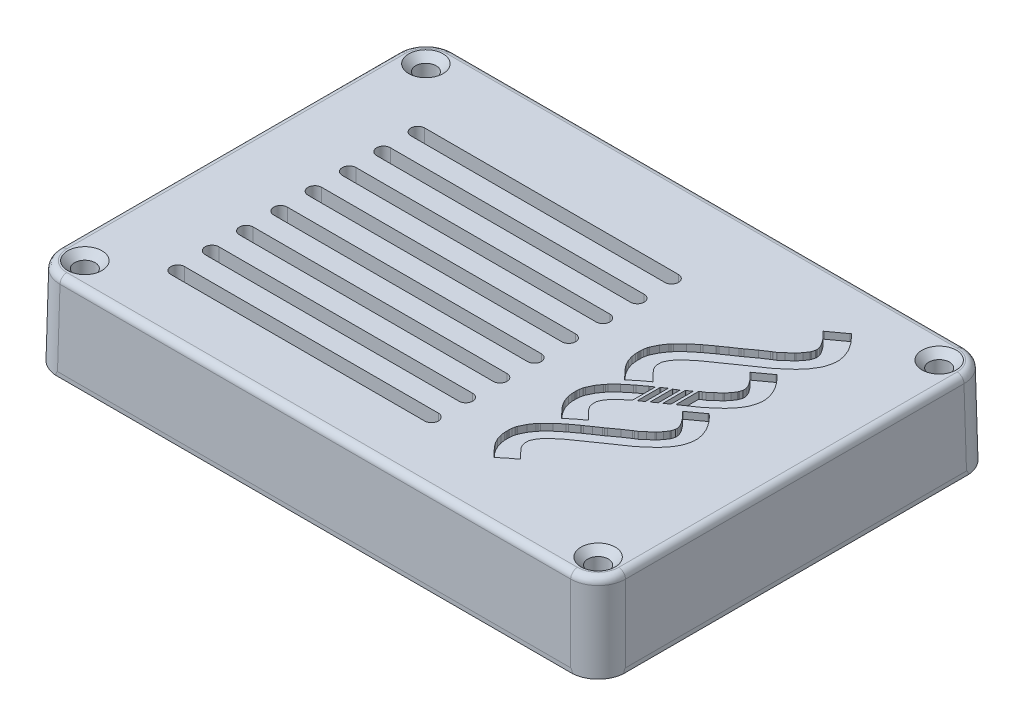
from build123d import *
from OCP.BRepFilletAPI import BRepFilletAPI_MakeChamfer

# Parameters (mm, degrees)
SKETCH1_W               = 82.8
SKETCH1_H               = 57.7
BOSS_EXTRUDE1_DEPTH     = 12.6
CHAMFER1_SIZE           = 12
CHAMFER1_SIZE2          = 0.2
FILLET1_R               = 4
SKETCH2_R               = 1.5
CUT_EXTRUDE1_DEPTH      = 12.6
FILLET2_R               = 1
CHAMFER2_SIZE           = 1
CUT_EXTRUDE2_DEPTH      = 10.4
CUT_EXTRUDE_THIN1_DEPTH = 1
CUT_EXTRUDE3_DEPTH      = 10.4
CUT_EXTRUDE5_DEPTH      = 1


with BuildPart() as part:
    # Sketch1 → Boss-Extrude1 (new body)
    with BuildSketch(Plane(origin=(0, 0, 0), x_dir=(1, 0, 0), z_dir=(0, 1, 0))):
        with Locations((-67.329666271, 2.285365627)):
            Rectangle(SKETCH1_W, SKETCH1_H)
    extrude(amount=BOSS_EXTRUDE1_DEPTH)

    # Chamfer1: one chamfer whose edges measure the first distance from different faces: ONE call of the kernel's chamfer builder (chamfer() names one face for all edges)
    chamfer1_edges_1 = [part.edges().sort_by_distance(p)[0] for p in [
        (-108.729666271, 12.6, -2.285365627),
    ]]
    chamfer1_side_1 = [part.faces().sort_by_distance(p)[0] for p in [
        (-108.729666271, 6.3, -2.285365627),
    ]]
    chamfer1_edges_2 = [part.edges().sort_by_distance(p)[0] for p in [
        (-67.329666271, 12.6, 26.564634373),
    ]]
    chamfer1_side_2 = [part.faces().sort_by_distance(p)[0] for p in [
        (-67.329666271, 6.3, 26.564634373),
    ]]
    chamfer1_edges_3 = [part.edges().sort_by_distance(p)[0] for p in [
        (-25.929666271, 12.6, -2.285365627),
    ]]
    chamfer1_side_3 = [part.faces().sort_by_distance(p)[0] for p in [
        (-25.929666271, 6.3, -2.285365627),
    ]]
    chamfer1_edges_4 = [part.edges().sort_by_distance(p)[0] for p in [
        (-67.329666271, 12.6, -31.135365627),
    ]]
    chamfer1_side_4 = [part.faces().sort_by_distance(p)[0] for p in [
        (-67.329666271, 6.3, -31.135365627),
    ]]
    chamfer1 = BRepFilletAPI_MakeChamfer(part.part.solid().wrapped)
    for e in chamfer1_edges_1:
        chamfer1.Add(CHAMFER1_SIZE, CHAMFER1_SIZE2, e.wrapped, chamfer1_side_1[0].wrapped)  # the first distance lies on this face
    for e in chamfer1_edges_2:
        chamfer1.Add(CHAMFER1_SIZE, CHAMFER1_SIZE2, e.wrapped, chamfer1_side_2[0].wrapped)  # the first distance lies on this face
    for e in chamfer1_edges_3:
        chamfer1.Add(CHAMFER1_SIZE, CHAMFER1_SIZE2, e.wrapped, chamfer1_side_3[0].wrapped)  # the first distance lies on this face
    for e in chamfer1_edges_4:
        chamfer1.Add(CHAMFER1_SIZE, CHAMFER1_SIZE2, e.wrapped, chamfer1_side_4[0].wrapped)  # the first distance lies on this face
    add(Compound.cast(chamfer1.Shape()), mode=Mode.REPLACE)

    # Fillet1
    # the kernel refuses this fillet: 4 mm, written as the material it takes off along each edge
    with BuildSketch(Plane(origin=(-108.896240397, -9.394447529, -31.301939752), x_dir=(0.9998611785930702, -0.016659725275086107, -0.0002776620879181018), z_dir=(0.016662038965156993, 0.9997223379094053, 0.016662038965156698)), Plane(origin=(-108.896240397, -9.394447529, 26.731208499), x_dir=(-0.0002776620879180821, -0.016659725275085812, -0.9998611785930703), z_dir=(0.016662038965156993, 0.9997223379094053, -0.016662038965156698))) as fillet1_piece_1:
        with BuildLine():
            CenterArc((FILLET1_R * 0.999722337909, -FILLET1_R), FILLET1_R, 90, 89.984088925)
            Line((-FILLET1_R * 0.000277623531772, -FILLET1_R * 0.999722299361), (0, 0))
            Line((0, 0), (FILLET1_R * 0.999722337909, 0))
        make_face()
    extrude(amount=31.997779629, mode=Mode.SUBTRACT)
    with BuildSketch(Plane(origin=(-25.763092146, -9.394447529, -31.301939752), x_dir=(-0.9998611785930702, -0.016659725275085812, -0.0002776620879180895), z_dir=(-0.016662038965156698, 0.9997223379094053, 0.016662038965156698)), Plane(origin=(-25.763092146, -9.394447529, 26.731208499), x_dir=(0.0002776620879180895, -0.016659725275085812, -0.9998611785930703), z_dir=(-0.016662038965156698, 0.9997223379094053, -0.016662038965156698))) as fillet1_piece_2:
        with BuildLine():
            CenterArc((FILLET1_R * 0.999722337909, FILLET1_R), FILLET1_R, 180.015911075, 89.984088925)
            Line((-FILLET1_R * 0.000277623531773, FILLET1_R * 0.999722299361), (0, 0))
            Line((0, 0), (FILLET1_R * 0.999722337909, 0))
        make_face()
    extrude(amount=31.997779629, mode=Mode.SUBTRACT)

    # Sketch2 → Cut-Extrude1 (cut)
    with BuildSketch(Plane.XZ):
        with Locations(Location((-104.739110754, 22.574078856, 0), (0, 0, 270))):
            Circle(SKETCH2_R)
        with Locations(Location((-29.920221788, 22.574078856, 0), (0, 0, 270))):
            Circle(SKETCH2_R)
        with Locations(Location((-104.739110754, -27.14481011, 0), (0, 0, 270))):
            Circle(SKETCH2_R)
        with Locations(Location((-29.920221788, -27.14481011, 0), (0, 0, 270))):
            Circle(SKETCH2_R)
    extrude(amount=-CUT_EXTRUDE1_DEPTH, mode=Mode.SUBTRACT)

    # Fillet2
    fillet2_edges = [part.edges().sort_by_distance(p)[0] for p in [
        (-67.329666271, 12.6, -30.935365627),
        (-67.329666271, 12.6, 26.364634373),
        (-26.129666271, 12.6, -2.285365627),
        (-108.529666271, 12.6, -2.285365627),
        (-107.358323444, 12.6, 25.193291546),
        (-27.301009098, 12.6, 25.193291546),
        (-27.301009098, 12.6, -29.7640228),
        (-107.358323444, 12.6, -29.7640228),
    ]]
    fillet(fillet2_edges, radius=FILLET2_R)

    # Chamfer2
    chamfer2_edges = [part.edges().sort_by_distance(p)[0] for p in [
        (-104.739110754, 12.6, 24.074078856),
        (-29.920221788, 12.6, 24.074078856),
        (-104.739110754, 12.6, -25.64481011),
        (-29.920221788, 12.6, -25.64481011),
    ]]
    chamfer(chamfer2_edges, length=CHAMFER2_SIZE)

    # Sketch3 → Cut-Extrude2 (cut)
    with BuildSketch(Plane.XZ):
        with BuildLine():
            Line((-99.765131832, 22.064634373), (-34.89420071, 22.064634373))
            ThreePointArc((-34.89420071, 22.064634373), (-33.455755694, 19.03854495), (-30.429666271, 17.600099934))
            Line((-30.429666271, 17.600099934), (-30.429666271, -22.170831188))
            ThreePointArc((-30.429666271, -22.170831188), (-33.455755694, -23.609276204), (-34.89420071, -26.635365627))
            Line((-34.89420071, -26.635365627), (-99.765131832, -26.635365627))
            ThreePointArc((-99.765131832, -26.635365627), (-101.203576848, -23.609276204), (-104.229666271, -22.170831188))
            Line((-104.229666271, -22.170831188), (-104.229666271, 17.600099934))
            ThreePointArc((-104.229666271, 17.600099934), (-101.203576848, 19.03854495), (-99.765131832, 22.064634373))
        make_face()
    extrude(amount=-CUT_EXTRUDE2_DEPTH, mode=Mode.SUBTRACT)

    # Sketch3<4> → Cut-Extrude-Thin1 (cut)
    with BuildSketch(Plane.XZ):
        with BuildLine():
            Line((-102.135604608, 24.064634373), (-32.523727934, 24.064634373))
            ThreePointArc((-32.523727934, 24.064634373), (-32.041542132, 20.452758513), (-28.429666271, 19.97057271))
            Line((-28.429666271, 19.97057271), (-28.429666271, -24.541303964))
            ThreePointArc((-28.429666271, -24.541303964), (-32.041542132, -25.023489766), (-32.523727934, -28.635365627))
            Line((-32.523727934, -28.635365627), (-102.135604608, -28.635365627))
            ThreePointArc((-102.135604608, -28.635365627), (-102.617790411, -25.023489766), (-106.229666271, -24.541303964))
            Line((-106.229666271, -24.541303964), (-106.229666271, 19.97057271))
            ThreePointArc((-106.229666271, 19.97057271), (-102.617790411, 20.452758513), (-102.135604608, 24.064634373))
        make_face()
        with BuildLine():
            Line((-100.769305307, 23.064634373), (-33.890027235, 23.064634373))
            ThreePointArc((-33.890027235, 23.064634373), (-32.748648913, 19.745651731), (-29.429666271, 18.604273409))
            Line((-29.429666271, 18.604273409), (-29.429666271, -23.175004663))
            ThreePointArc((-29.429666271, -23.175004663), (-32.748648913, -24.316382985), (-33.890027235, -27.635365627))
            Line((-33.890027235, -27.635365627), (-100.769305307, -27.635365627))
            ThreePointArc((-100.769305307, -27.635365627), (-101.910683629, -24.316382985), (-105.229666271, -23.175004663))
            Line((-105.229666271, -23.175004663), (-105.229666271, 18.604273409))
            ThreePointArc((-105.229666271, 18.604273409), (-101.910683629, 19.745651731), (-100.769305307, 23.064634373))
        make_face(mode=Mode.SUBTRACT)
    extrude(amount=-CUT_EXTRUDE_THIN1_DEPTH, mode=Mode.SUBTRACT)

    # Sketch4 → Cut-Extrude3 (cut)
    with BuildSketch(Plane(origin=(0, 12.6, 0), x_dir=(1, 0, 0), z_dir=(0, 1, 0))):
        with BuildLine():
            Line((-96.729666271, 18.951893414), (-59.729666271, 18.951893414))
            ThreePointArc((-59.729666271, 18.951893414), (-58.729666271, 17.951893414), (-59.729666271, 16.951893414))
            Line((-59.729666271, 16.951893414), (-96.729666271, 16.951893414))
            ThreePointArc((-96.729666271, 16.951893414), (-97.729666271, 17.951893414), (-96.729666271, 18.951893414))
        make_face()
        with BuildLine():
            Line((-96.729666271, 13.951893414), (-59.729666271, 13.951893414))
            ThreePointArc((-59.729666271, 13.951893414), (-58.729666271, 12.951893414), (-59.729666271, 11.951893414))
            Line((-59.729666271, 11.951893414), (-96.729666271, 11.951893414))
            ThreePointArc((-96.729666271, 11.951893414), (-97.729666271, 12.951893414), (-96.729666271, 13.951893414))
        make_face()
        with BuildLine():
            Line((-96.729666271, 8.951893414), (-59.729666271, 8.951893414))
            ThreePointArc((-59.729666271, 8.951893414), (-58.729666271, 7.951893414), (-59.729666271, 6.951893414))
            Line((-59.729666271, 6.951893414), (-96.729666271, 6.951893414))
            ThreePointArc((-96.729666271, 6.951893414), (-97.729666271, 7.951893414), (-96.729666271, 8.951893414))
        make_face()
        with BuildLine():
            Line((-96.729666271, 3.951893414), (-59.729666271, 3.951893414))
            ThreePointArc((-59.729666271, 3.951893414), (-58.729666271, 2.951893414), (-59.729666271, 1.951893414))
            Line((-59.729666271, 1.951893414), (-96.729666271, 1.951893414))
            ThreePointArc((-96.729666271, 1.951893414), (-97.729666271, 2.951893414), (-96.729666271, 3.951893414))
        make_face()
        with BuildLine():
            Line((-96.729666271, -1.048106586), (-59.729666271, -1.048106586))
            ThreePointArc((-59.729666271, -1.048106586), (-58.729666271, -2.048106586), (-59.729666271, -3.048106586))
            Line((-59.729666271, -3.048106586), (-96.729666271, -3.048106586))
            ThreePointArc((-96.729666271, -3.048106586), (-97.729666271, -2.048106586), (-96.729666271, -1.048106586))
        make_face()
        with BuildLine():
            Line((-96.729666271, -6.048106586), (-59.729666271, -6.048106586))
            ThreePointArc((-59.729666271, -6.048106586), (-58.729666271, -7.048106586), (-59.729666271, -8.048106586))
            Line((-59.729666271, -8.048106586), (-96.729666271, -8.048106586))
            ThreePointArc((-96.729666271, -8.048106586), (-97.729666271, -7.048106586), (-96.729666271, -6.048106586))
        make_face()
        with BuildLine():
            Line((-96.729666271, -11.048106586), (-59.729666271, -11.048106586))
            ThreePointArc((-59.729666271, -11.048106586), (-58.729666271, -12.048106586), (-59.729666271, -13.048106586))
            Line((-59.729666271, -13.048106586), (-96.729666271, -13.048106586))
            ThreePointArc((-96.729666271, -13.048106586), (-97.729666271, -12.048106586), (-96.729666271, -11.048106586))
        make_face()
        with BuildLine():
            Line((-96.729666271, -16.048106586), (-59.729666271, -16.048106586))
            ThreePointArc((-59.729666271, -16.048106586), (-58.729666271, -17.048106586), (-59.729666271, -18.048106586))
            Line((-59.729666271, -18.048106586), (-96.729666271, -18.048106586))
            ThreePointArc((-96.729666271, -18.048106586), (-97.729666271, -17.048106586), (-96.729666271, -16.048106586))
        make_face()
    extrude(amount=-CUT_EXTRUDE3_DEPTH, mode=Mode.SUBTRACT)

    # Sketch5 → Cut-Extrude5 (cut)
    with BuildSketch(Plane(origin=(0, 12.6, -12.6), x_dir=(1, 0, 0), z_dir=(0, -1, 0))):
        Polygon((-52.474635672, 25.551335505), (-52.474635672, 25.659671505), (-52.474635672, 25.706020305), (-52.473099672, 25.828938705), (-52.472523672, 25.843530705), (-52.472043672, 25.862788305), (-52.472043672, 25.872685905), (-52.470891672, 25.952903505), (-52.470891672, 25.979457105), (-52.470891672, 26.013316305), (-52.471467672, 26.018529105), (-52.471467672, 26.062276305), (-52.471467672, 26.076340305), (-52.471467672, 26.279457105), (-52.382955672, 26.887789905), (-52.154763672, 27.595089105), (-51.844395672, 28.189348305), (-51.599019672, 28.550298705), (-51.508491672, 28.662791505), (-51.454251672, 28.731018705), (-51.282891672, 28.929460305), (-50.980971672, 29.261231505), (-50.603307672, 29.658107025), (-50.265291672, 30.003419025), (-50.151723672, 30.117481809), (-50.075211672, 30.195085905), (-49.994379672, 30.121648401), (-49.899051672, 30.035190225), (-48.868971672, 29.194564305), (-48.755883672, 29.111226705), (-48.012651672, 28.562788305), (-47.906379672, 28.484673105), (-47.999595672, 28.390909905), (-48.109035672, 28.281537105), (-48.435051672, 27.950817105), (-48.793323672, 27.577377105), (-49.072011672, 27.275303505), (-49.218891672, 27.107063505), (-49.265355672, 27.049242705), (-49.309995672, 26.994561105), (-49.526283672, 26.627380305), (-49.653867672, 26.196129105), (-49.653867672, 26.052378705), (-49.653867672, 26.037796305), (-49.653867672, 26.033629905), (-49.653291672, 25.993002705), (-49.653291672, 25.978938705), (-49.653291672, 25.939348305), (-49.654827672, 25.833633105), (-49.654827672, 25.820087505), (-49.655307672, 25.803421905), (-49.655307672, 25.791969105), (-49.655883672, 25.782061905), (-49.656939672, 25.690391505), (-49.656939672, 25.659671505), (-49.656939672, 25.627377105), (-49.653291672, 25.533633105), (-49.652811672, 25.528938705), (-49.614795672, 25.419047505), (-49.375179672, 24.911236305), (-49.073067672, 24.465393105), (-49.003371672, 24.385713105), (-48.871467672, 24.234676305), (-48.139755672, 23.508628305), (-47.300139672, 22.809671505), (-47.113707672, 22.672161105), (-44.094891672, 20.554957905), (-42.072075672, 19.160173905), (-41.981451672, 19.097197905), (-41.147595672, 18.522733905), (-41.142315672, 18.518509905), (-41.137707672, 18.514381905), (-39.982453272, 17.506573905), (-39.560571672, 17.133613905), (-39.556414872, 17.129485905), (-39.457976472, 17.032621905), (-39.453291672, 17.027917905), (-39.352242072, 16.918477905), (-39.051205272, 16.585741905), (-38.648600472, 16.098157905), (-38.271522072, 15.547789905), (-38.014750872, 15.079501905), (-37.943912472, 14.916973905), (-37.883490072, 14.777389905), (-37.671003672, 14.076301905), (-37.579333272, 13.447789905), (-37.579333272, 13.237741905), (-37.579333272, 12.977869905), (-37.723083672, 12.198157905), (-38.055896472, 11.343469905), (-38.150677272, 11.175373905), (-38.227774872, 11.038861905), (-38.474120472, 10.636717905), (-38.836626072, 10.125709905), (-39.280894872, 9.609613905), (-39.702776472, 9.187789905), (-39.849637272, 9.053869905), (-39.918910872, 8.991469905), (-39.993906072, 9.046189905), (-42.060555672, 10.553389905), (-42.175179672, 10.636717905), (-42.068907672, 10.731085905), (-41.905419672, 10.875757905), (-41.233995672, 11.574253905), (-40.720971672, 12.281101905), (-40.636587672, 12.429997905), (-40.595979672, 12.502957905), (-40.456395672, 12.845581905), (-40.397547672, 13.140973905), (-40.397547672, 13.239373905), (-40.397547672, 13.406029905), (-40.525707672, 13.846189905), (-40.551243672, 13.905517905), (-40.604331672, 14.027917905), (-40.974123672, 14.590957905), (-41.436651672, 15.123757905), (-41.536107672, 15.231085905), (-42.220491672, 15.836269905), (-42.836139672, 16.380589905), (-42.865803672, 16.397773905), (-43.171563672, 16.581517905), (-43.202763672, 16.600813905), (-43.377771672, 16.709581905), (-44.372523672, 17.381005905), (-45.518379672, 18.218029905), (-45.768939672, 18.409165905), (-45.942411672, 18.519085905), (-46.785579672, 19.089325905), (-47.578251672, 19.655533905), (-47.726283672, 19.762765905), (-47.736171672, 19.750861905), (-47.822571672, 19.814317905), (-48.841899672, 20.566477905), (-49.069419672, 20.734151505), (-50.101707672, 21.594570705), (-51.009963672, 22.498209105), (-51.175179672, 22.687271505), (-51.303339672, 22.833633105), (-51.852267672, 23.640916305), (-52.277163672, 24.543009105), (-52.342923672, 24.736228305), (-52.372011672, 24.821649105), (-52.452843672, 25.226337105), align=None)
        Polygon((-39.918910872, -0.871570095), (-39.993906072, -0.816946095), (-42.060555672, 0.690445905), (-42.175179672, 0.773773905), (-42.068907672, 0.868045905), (-41.905419672, 1.012813905), (-41.233995672, 1.711213905), (-40.720971672, 2.418061905), (-40.636587672, 2.566957905), (-40.595979672, 2.639917905), (-40.455915672, 2.982541905), (-40.397547672, 3.277933905), (-40.397547672, 3.376237905), (-40.397547672, 3.542989905), (-40.525131672, 3.983053905), (-40.550667672, 4.042381905), (-40.603851672, 4.164781905), (-40.974123672, 4.727917905), (-41.436651672, 5.261197905), (-41.536107672, 5.368525905), (-42.220491672, 5.973229905), (-42.836139672, 6.517453905), (-42.865227672, 6.534637905), (-43.170987672, 6.718573905), (-43.202763672, 6.737773905), (-43.226763672, 6.752461905), (-43.469931672, 6.907597905), (-43.494987672, 6.923725905), (-43.494987672, 10.277869905), (-42.072075672, 9.297229905), (-41.981451672, 9.234637905), (-41.147595672, 8.659597905), (-41.142315672, 8.656045905), (-41.137707672, 8.651341905), (-39.982453272, 7.643533905), (-39.560571672, 7.270573905), (-39.558498072, 7.268557905), (-39.555896472, 7.266445905), (-39.457976472, 7.169581905), (-39.455893272, 7.167469905), (-39.452773272, 7.164781905), (-39.351723672, 7.055533905), (-39.051205272, 6.722701905), (-38.648600472, 6.235213905), (-38.271522072, 5.684653905), (-38.014750872, 5.216461905), (-37.943912472, 5.053837905), (-37.883490072, 4.914445905), (-37.671003672, 4.213357905), (-37.579333272, 3.585229905), (-37.579333272, 3.375373905), (-37.579333272, 3.115309905), (-37.723083672, 2.335213905), (-38.055896472, 1.480525905), (-38.150677272, 1.312237905), (-38.227774872, 1.175725905), (-38.474120472, 0.773773905), (-38.836626072, 0.262861905), (-39.280894872, -0.253330095), (-39.703294872, -0.675154095), (-39.850165272, -0.809074095), align=None)
        Polygon((-47.386635672, 13.014829905), (-47.211627672, 12.883597905), (-47.211627672, 9.528973905), (-47.255883672, 9.560653905), (-47.685099672, 9.870061905), (-47.726283672, 9.899725905), (-47.736171672, 9.887725905), (-47.822571672, 9.951853905), (-48.841899672, 10.703341905), (-49.069419672, 10.871053905), (-50.101707672, 11.731981905), (-51.009579672, 12.635245905), (-51.174699672, 12.824269905), (-51.302763672, 12.970573905), (-51.852267672, 13.777933905), (-52.277739672, 14.680045905), (-52.343307672, 14.873197905), (-52.372491672, 14.958637905), (-52.452843672, 15.363373905), (-52.474635672, 15.688237905), (-52.474635672, 15.796717905), (-52.474635672, 15.842989905), (-52.473099672, 15.965869905), (-52.472523672, 15.980557905), (-52.472043672, 15.999757905), (-52.472043672, 16.009645905), (-52.470891672, 16.090381905), (-52.470891672, 16.116973905), (-52.470891672, 16.150861905), (-52.471467672, 16.156045905), (-52.471467672, 16.199245905), (-52.471467672, 16.213357905), (-52.471467672, 16.416397905), (-52.382955672, 17.024749905), (-52.154763672, 17.732077905), (-51.844395672, 18.326317905), (-51.599019672, 18.687277905), (-51.508491672, 18.799789905), (-51.454251672, 18.868045905), (-51.282891672, 19.066477905), (-50.980971672, 19.398157905), (-50.603307672, 19.795117905), (-50.265291672, 20.140429905), (-50.151723672, 20.254477905), (-50.074635672, 20.332045905), (-49.994379672, 20.258605905), (-49.899051672, 20.172205905), (-48.868971672, 19.331533905), (-48.755883672, 19.248205905), (-48.012651672, 18.700333905), (-47.906379672, 18.621613905), (-47.999595672, 18.527917905), (-48.109035672, 18.418477905), (-48.435051672, 18.087757905), (-48.793899672, 17.714317905), (-49.072011672, 17.412301905), (-49.219467672, 17.244589905), (-49.265739672, 17.186221905), (-49.309995672, 17.131501905), (-49.526283672, 16.764397905), (-49.653867672, 16.333069905), (-49.653867672, 16.189357905), (-49.653867672, 16.174861905), (-49.653867672, 16.170541905), (-49.653291672, 16.130029905), (-49.653291672, 16.115917905), (-49.653291672, 16.076269905), (-49.655307672, 15.971053905), (-49.655307672, 15.957613905), (-49.655307672, 15.928909905), (-49.655883672, 15.919117905), (-49.656939672, 15.827341905), (-49.656939672, 15.796717905), (-49.656939672, 15.764461905), (-49.653291672, 15.670573905), (-49.652811672, 15.665869905), (-49.614795672, 15.556045905), (-49.375179672, 15.048109905), (-49.073067672, 14.602381905), (-49.003371672, 14.522701905), (-48.877707672, 14.378989905), (-48.181515672, 13.684141905), align=None)
        Polygon((-44.537643672, 7.746157905), (-44.598123672, 7.788301905), (-44.598123672, 7.924813905), (-44.598123672, 11.044525905), (-44.094891672, 10.703341905), (-43.902795672, 10.574797905), (-43.902795672, 7.319053905), (-43.957995672, 7.355533905), align=None)
        Polygon((-46.804299672, 12.592045905), (-46.108491672, 12.104461905), (-46.108491672, 8.767981905), (-46.167915672, 8.807053905), (-46.748139672, 9.200269905), (-46.804299672, 9.239917905), align=None)
        Polygon((-45.637611672, 8.520013905), (-45.701163672, 8.563885905), (-45.701163672, 11.818573905), (-45.005835672, 11.330509905), (-45.005835672, 8.116909905), (-45.069483672, 8.158189905), (-45.352779672, 8.336269905), align=None)
        Polygon((-52.875243672, 5.974285905), (-52.875243672, 6.088813905), (-52.875243672, 6.137773905), (-52.874091672, 6.268525905), (-52.873611672, 6.283597905), (-52.873035672, 6.302989905), (-52.873035672, 6.313357905), (-52.871499672, 6.397741905), (-52.871499672, 6.425389905), (-52.871499672, 6.460717905), (-52.871979672, 6.466381905), (-52.871979672, 6.512269905), (-52.871979672, 6.527341905), (-52.871979672, 6.741517905), (-52.778763672, 7.383661905), (-52.538091672, 8.130061905), (-52.210539672, 8.757613905), (-51.951723672, 9.137773905), (-51.855915672, 9.256525905), (-51.798699672, 9.328429905), (-51.618411672, 9.536653905), (-51.300651672, 9.886669905), (-50.903307672, 10.304461905), (-50.547627672, 10.668013905), (-50.427723672, 10.788301905), (-50.338155672, 10.878445905), (-50.243883672, 10.792909905), (-50.143371672, 10.701901905), (-49.060491672, 9.818029905), (-48.941835672, 9.730573905), (-48.160011672, 9.153901905), (-48.035595672, 9.062317905), (-48.144939672, 8.952973905), (-48.260043672, 8.837773905), (-48.602283672, 8.489869905), (-48.979851672, 8.097229905), (-49.272555672, 7.779469905), (-49.427211672, 7.602925905), (-49.475691672, 7.542061905), (-49.513707672, 7.495117905), (-49.617291672, 7.345069905), (-49.748139672, 7.101901905), (-49.843851672, 6.819085905), (-49.880907672, 6.581485905), (-49.880907672, 6.501901905), (-49.880907672, 6.486637905), (-49.880907672, 6.471661905), (-49.880427672, 6.436717905), (-49.880427672, 6.424813905), (-49.880427672, 6.383053905), (-49.882443672, 6.271117905), (-49.882443672, 6.257101905), (-49.882923672, 6.239917905), (-49.882923672, 6.227917905), (-49.883499672, 6.217453905), (-49.884555672, 6.121069905), (-49.884555672, 6.088813905), (-49.884555672, 6.055501905), (-49.880907672, 5.959117905), (-49.880427672, 5.954413905), (-49.840299672, 5.839309905), (-49.589163672, 5.307661905), (-49.273035672, 4.840909905), (-49.200171672, 4.757581905), (-49.061643672, 4.599181905), (-48.292971672, 3.835789905), (-47.409963672, 3.100813905), (-47.214315672, 2.956525905), (-44.039211672, 0.729517905), (-41.911083672, -0.737746095), (-41.815275672, -0.803890095), (-40.938219672, -1.408498095), (-40.931979672, -1.412818095), (-40.926219672, -1.418002095), (-39.711109272, -2.478898095), (-39.267349272, -2.870482095), (-39.262146072, -2.875762095), (-39.158494872, -2.977810095), (-39.153291672, -2.983090095), (-39.015272472, -3.131986095), (-38.305890072, -3.962770095), (-37.666309272, -4.969426095), (-37.563186072, -5.207602095), (-37.499643672, -5.354962095), (-37.275157272, -6.094546095), (-37.178293272, -6.757618095), (-37.178293272, -6.978898095), (-37.178293272, -7.252786095), (-37.329858072, -8.076274095), (-37.681410072, -8.977810095), (-37.781413272, -9.155410095), (-37.893387672, -9.353362095), (-38.503813272, -10.261138095), (-39.344965272, -11.184658095), (-39.571525272, -11.390866095), (-39.652242072, -11.463730095), (-39.739746072, -11.399698095), (-41.914251672, -9.814258095), (-42.048075672, -9.716338095), (-41.924139672, -9.606514095), (-41.752203672, -9.454354095), (-41.047083672, -8.721010095), (-40.508523672, -7.978354095), (-40.419915672, -7.822066095), (-40.377771672, -7.746130095), (-40.231371672, -7.388818095), (-40.169931672, -7.080370095), (-40.169931672, -6.977842095), (-40.169931672, -6.803890095), (-40.303851672, -6.344530095), (-40.330347672, -6.282514095), (-40.386123672, -6.154354095), (-40.773579672, -5.564242095), (-41.259531672, -5.004370095), (-41.363691672, -4.891282095), (-42.083499672, -4.255954095), (-42.729867672, -3.684082095), (-42.760587672, -3.666418095), (-43.081899672, -3.473170095), (-43.114731672, -3.452818095), (-43.299147672, -3.338290095), (-44.346027672, -2.631442095), (-45.551211672, -1.750738095), (-45.814827672, -1.549714095), (-45.996555672, -1.435186095), (-46.878795672, -0.838258095), (-47.709099672, -0.245554095), (-47.864235672, -0.133042095), (-47.874699672, -0.145618095), (-47.975691672, -0.071026095), (-49.048107672, 0.719629905), (-49.287627672, 0.896173905), (-50.374635672, 1.802413905), (-51.330891672, 2.753869905), (-51.504843672, 2.952973905), (-51.639723672, 3.107053905), (-52.218891672, 3.958189905), (-52.667307672, 4.909069905), (-52.736715672, 5.112781905), (-52.767339672, 5.202925905), (-52.852299672, 5.630509905), align=None)
    extrude(amount=CUT_EXTRUDE5_DEPTH, mode=Mode.SUBTRACT)


solid = part.part
